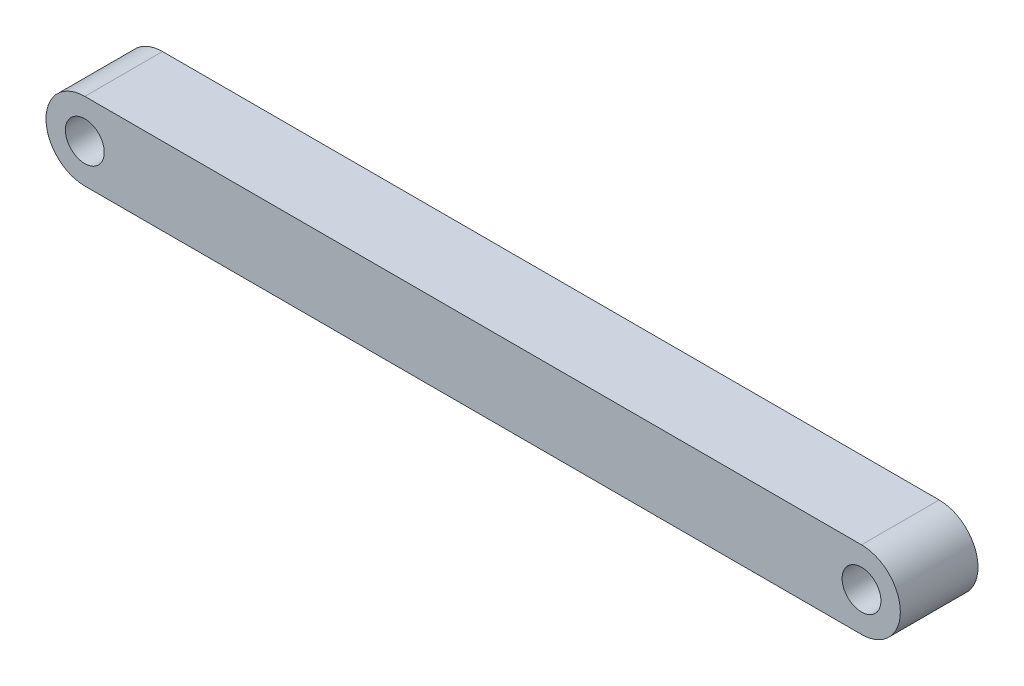
from build123d import *

# Parameters (mm, degrees)
BOSS_EXTRU_1_DEPTH      = 3
BOSS_EXTRU_1_DEPTH_BACK = 3
ESQUISSE1_R             = 1.5


with BuildPart() as part:
    # Esquisse1 → Boss.-Extru.1 (new, two sides: drawn at the far end of the back side and taken through both)
    with BuildSketch(Plane.XY.offset(-BOSS_EXTRU_1_DEPTH_BACK)):
        with BuildLine():
            Line((0, 3), (60, 3))
            ThreePointArc((60, 3), (63, 0), (60, -3))
            Line((60, -3), (0, -3))
            ThreePointArc((0, -3), (-3, 0), (0, 3))
        make_face()
        Circle(ESQUISSE1_R, mode=Mode.SUBTRACT)
        with Locations((60, 0)):
            Circle(ESQUISSE1_R, mode=Mode.SUBTRACT)
    extrude(amount=BOSS_EXTRU_1_DEPTH + BOSS_EXTRU_1_DEPTH_BACK)


solid = part.part
